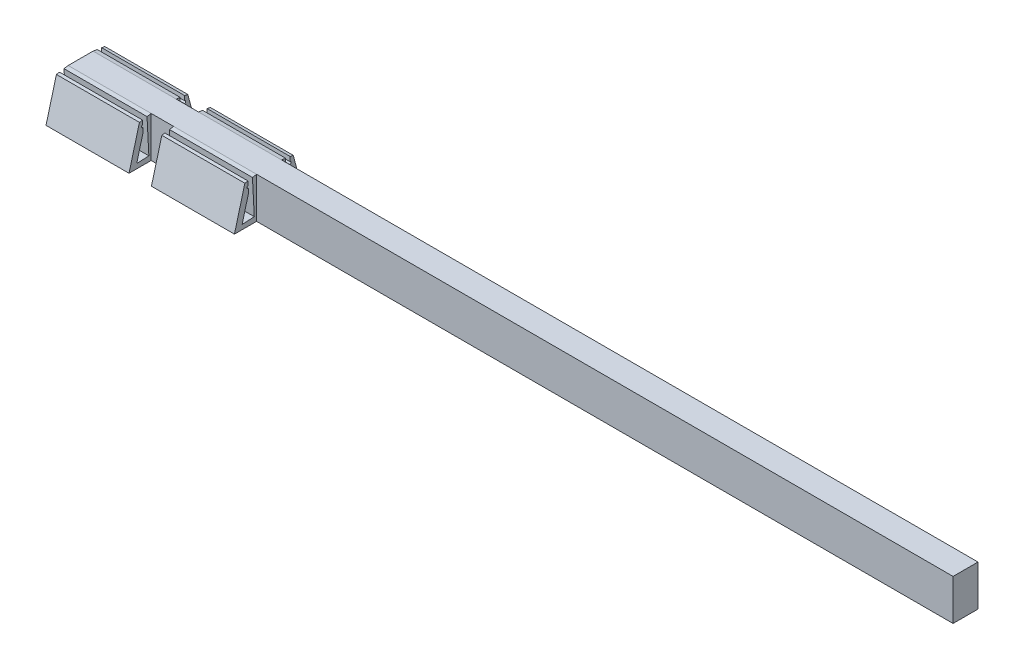
from build123d import *

# Parameters (mm, degrees)
CLIP_1_DEPTH        = 10
SKETCH4_W           = 6.003992509
SKETCH4_H           = 9.824299843
CENTER_BEAM_DEPTH   = 203.2
BOSS_EXTRUDE9_DEPTH = 10


with BuildPart() as part:
    # Sketch1 → Clip #1 (new, symmetric)
    with BuildSketch(Plane(origin=(0, 0, 0), x_dir=(0, 0, -1), z_dir=(1, 0, 0))):
        with BuildLine():
            Line((6.081551938, 6.841542851), (7.61911384, 1.103283712))
            Line((7.61911384, 1.103283712), (4.687365208, 1.256930148))
            Line((4.687365208, 1.256930148), (5.127959845, 9.663976652))
            Line((5.127959845, 9.663976652), (4.1299561, 9.824299843))
            Line((4.1299561, 9.824299843), (-1.874036409, 9.824299843))
            Line((-1.874036409, 9.824299843), (-2.872040155, 9.663976652))
            Line((-2.872040155, 9.663976652), (-2.431445517, 1.256930148))
            Line((-2.431445517, 1.256930148), (-5.36319415, 1.103283712))
            Line((-5.36319415, 1.103283712), (-3.825632248, 6.841542851))
            Line((-3.825632248, 6.841542851), (-3.879292118, 7.86543416))
            ThreePointArc((-3.879292118, 7.86543416), (-4.194581765, 8.149322234), (-3.910693691, 8.464611881))
            Line((-3.910693691, 8.464611881), (-3.964353561, 9.488503191))
            Line((-3.964353561, 9.488503191), (-4.701004321, 9.370164756))
            Line((-4.701004321, 9.370164756), (-7.2117324, 0))
            Line((-7.2117324, 0), (-2.365572599, 0))
            Line((-2.365572599, 0), (4.62149229, 0))
            Line((4.62149229, 0), (9.46765209, 0))
            Line((9.46765209, 0), (6.956924011, 9.370164756))
            Line((6.956924011, 9.370164756), (6.220273251, 9.488503191))
            Line((6.220273251, 9.488503191), (6.166613382, 8.464611881))
            ThreePointArc((6.166613382, 8.464611881), (6.450501455, 8.149322234), (6.135211808, 7.86543416))
            Line((6.135211808, 7.86543416), (6.081551938, 6.841542851))
        make_face()
    extrude(amount=CLIP_1_DEPTH, both=True)

    # Sketch4 → Center beam (add)
    with BuildSketch(Plane(origin=(0, 0, 0), x_dir=(0, 0, -1), z_dir=(1, 0, 0))):
        with Locations((1.127959845, 4.912149922)):
            Rectangle(SKETCH4_W, SKETCH4_H)
    extrude(amount=CENTER_BEAM_DEPTH)

    # Sketch6 → Boss-Extrude9 (add, symmetric)
    with BuildSketch(Plane(origin=(25.4, 0, 0), x_dir=(0, 0, -1), z_dir=(1, 0, 0))):
        with BuildLine():
            Line((7.61911384, 1.103283712), (4.687365208, 1.256930148))
            Line((4.687365208, 1.256930148), (5.127959845, 9.663976652))
            Line((5.127959845, 9.663976652), (4.1299561, 9.824299843))
            Line((4.1299561, 9.824299843), (-1.874036409, 9.824299843))
            Line((-1.874036409, 9.824299843), (-2.872040155, 9.663976652))
            Line((-2.872040155, 9.663976652), (-2.431445517, 1.256930148))
            Line((-2.431445517, 1.256930148), (-5.36319415, 1.103283712))
            Line((-5.36319415, 1.103283712), (-3.825632248, 6.841542851))
            Line((-3.825632248, 6.841542851), (-3.879292118, 7.86543416))
            ThreePointArc((-3.879292118, 7.86543416), (-4.194581765, 8.149322234), (-3.910693691, 8.464611881))
            Line((-3.910693691, 8.464611881), (-3.964353561, 9.488503191))
            Line((-3.964353561, 9.488503191), (-4.701004321, 9.370164756))
            Line((-4.701004321, 9.370164756), (-7.2117324, 0))
            Line((-7.2117324, 0), (-2.365572599, 0))
            Line((-2.365572599, 0), (4.62149229, 0))
            Line((4.62149229, 0), (9.46765209, 0))
            Line((9.46765209, 0), (6.956924011, 9.370164756))
            Line((6.956924011, 9.370164756), (6.220273251, 9.488503191))
            Line((6.220273251, 9.488503191), (6.166613382, 8.464611881))
            ThreePointArc((6.166613382, 8.464611881), (6.450501455, 8.149322234), (6.135211808, 7.86543416))
            Line((6.135211808, 7.86543416), (6.081551938, 6.841542851))
            Line((6.081551938, 6.841542851), (7.61911384, 1.103283712))
        make_face()
    extrude(amount=BOSS_EXTRUDE9_DEPTH, both=True)


solid = part.part
